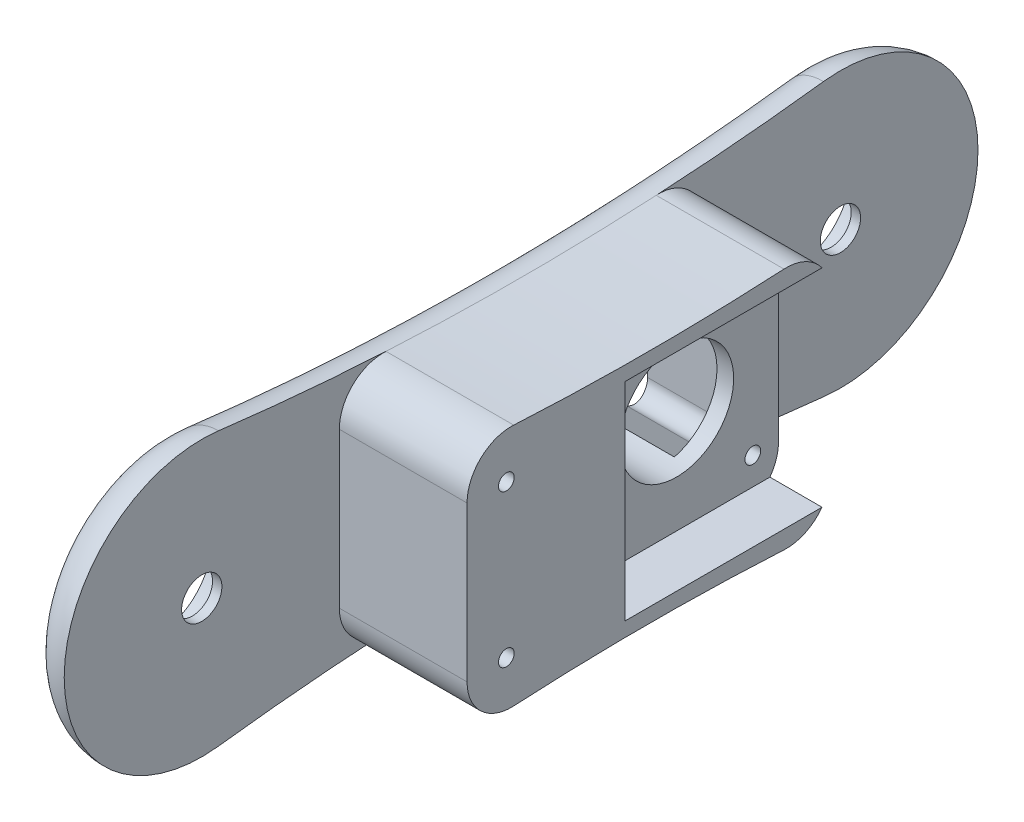
from build123d import *

# Parameters (mm, degrees)
BOSS_EXTRUDE1_DEPTH     = 35
CUT_EXTRUDE1_DEPTH      = 165.23458831805192
CUT_EXTRUDE1_DEPTH_BACK = 165.23458831805192
CUT_EXTRUDE2_START      = 35
CUT_EXTRUDE2_DEPTH      = 10.61
SKETCH5_R               = 1.600000000000005
SKETCH5_R_2             = 1.6000000000000056
CUT_EXTRUDE3_DEPTH      = 165.23458831805192
SKETCH5_3_R             = 3.0000000000000004
SKETCH5_3_R_2           = 3.0000000000000013
CUT_EXTRUDE4_DEPTH      = 21
SKETCH8_R               = 1.600000000000005
SKETCH8_R_2             = 1.6000000000000056
CUT_EXTRUDE5_DEPTH      = 165.23458831805192
SKETCH8_3_R             = 3.000000000000008
CUT_EXTRUDE6_DEPTH      = 25
CUT_EXTRUDE7_REACH      = 166.235
SKETCH7_R               = 4.1
SKETCH7_R_2             = 4.099999999999986
SKETCH7_3_R             = 11
SKETCH7_3_R_2           = 10.999999999999993
CUT_EXTRUDE8_DEPTH      = 7.1
CUT_EXTRUDE9_DEPTH      = 21
CUT_EXTRUDE11_START     = 24.39
SKETCH11_R              = 11.6
CUT_EXTRUDE11_DEPTH     = 189.6245883180519
FILLET3_R               = 9
FILLET4_R               = 9


with BuildPart() as part:
    # Sketch1 → Boss-Extrude1 (new body)
    with BuildSketch(Plane(origin=(0, 0, 0), x_dir=(0, 0, -1), z_dir=(1, 0, 0))):
        with BuildLine():
            ThreePointArc((-3.4331525583588727, 27.788729073331762), (-20.97770568525129, 18.545507924642443), (-28, 3.43e-15))
            Line((-28, 0), (28, 0))
            ThreePointArc((28, 0), (18.545507924642447, 20.977705685251287), (-3.4331525583588727, 27.788729073331762))
        make_face()
        with BuildLine():
            Line((28, 0), (-28, 0))
            ThreePointArc((-28, 3.43e-15), (-20.977705685251298, -18.545507924642436), (-3.433152558358892, -27.78872907333176))
            ThreePointArc((-3.433152558358892, -27.78872907333176), (18.545507924642436, -20.977705685251298), (28, -6.86e-15))
        make_face()
        with BuildLine():
            ThreePointArc((-126.56684744164114, 27.788729073331766), (-109.02229431474872, 18.54550792464245), (-102, 0))
            Line((-102, 0), (-28, 0))
            ThreePointArc((-28, 3.43e-15), (-20.97770568525129, 18.545507924642443), (-3.4331525583588727, 27.788729073331762))
            ThreePointArc((-3.433152558358863, 27.788729073331695), (-65, 23.999999999999602), (-126.56684744164116, 27.788729073331638))
        make_face()
        with BuildLine():
            Line((-28, 0), (-102, 0))
            ThreePointArc((-102, -6.86e-15), (-109.0222943147487, -18.545507924642447), (-126.56684744164114, -27.788729073331766))
            ThreePointArc((-126.56684744164116, -27.788729073331638), (-65, -23.999999999999602), (-3.433152558358863, -27.788729073331695))
            ThreePointArc((-3.433152558358892, -27.78872907333176), (-20.977705685251298, -18.545507924642436), (-28, 3.43e-15))
        make_face()
        with BuildLine():
            ThreePointArc((-126.56684744164114, 27.788729073331766), (-148.54550792464244, 20.977705685251287), (-158, 3.43e-15))
            Line((-158, 0), (-102, 0))
            ThreePointArc((-102, 0), (-109.02229431474872, 18.54550792464245), (-126.56684744164114, 27.788729073331766))
        make_face()
        with BuildLine():
            Line((-102, 0), (-158, 0))
            ThreePointArc((-158, 3.43e-15), (-148.54550792464244, -20.97770568525128), (-126.56684744164114, -27.788729073331766))
            ThreePointArc((-126.56684744164114, -27.788729073331766), (-109.0222943147487, -18.545507924642447), (-102, -6.86e-15))
        make_face()
    extrude(amount=BOSS_EXTRUDE1_DEPTH)

    # Sketch4 → Cut-Extrude1 (cut, two sides: drawn at the far end of the back side and taken through both)
    with BuildSketch(Plane(origin=(0, 0, 0), x_dir=(1, 0, 0), z_dir=(0, 1, 0)).offset(-CUT_EXTRUDE1_DEPTH_BACK)):
        Polygon((8.999999999999998, 27.999999999999996), (61, 27.999999999999996), (61, -28.000000000000004), (9.000000000000005, -28.000000000000004), align=None)
        Polygon((60.999999999999986, -157.99999999999997), (60.99999999999993, -101.99999999999999), (8.999999999999956, -101.99999999999999), (8.99999999999997, -157.99999999999997), align=None)
    extrude(amount=CUT_EXTRUDE1_DEPTH + CUT_EXTRUDE1_DEPTH_BACK, mode=Mode.SUBTRACT)

    # Sketch6 → Cut-Extrude2 (cut)
    with BuildSketch(Plane(origin=(0, 0, 0), x_dir=(0, 0, -1), z_dir=(1, 0, 0)).offset(CUT_EXTRUDE2_START)):
        Polygon((-27.624999999999996, -21.1), (-69.825, -21.100000000000005), (-69.825, 21.099999999999994), (-27.624999999999996, 21.1), align=None)
    extrude(amount=-CUT_EXTRUDE2_DEPTH, mode=Mode.SUBTRACT)

    # Sketch5 → Cut-Extrude3 (cut, through all)
    with BuildSketch(Plane(origin=(0, 0, 0), x_dir=(0, 0, -1), z_dir=(1, 0, 0))):
        with Locations(Location((-33.225, -15.5, 0), (0, 0, 180))):
            Circle(SKETCH5_R)
        with Locations(Location((-33.225, 15.5, 0), (0, 0, 180))):
            Circle(SKETCH5_R)
        with Locations(Location((-64.22500000000001, -15.500000000000004, 0), (0, 0, 180))):
            Circle(SKETCH5_R)
        with Locations(Location((-64.22500000000001, 15.499999999999995, 0), (0, 0, 180))):
            Circle(SKETCH5_R_2)
    extrude(amount=CUT_EXTRUDE3_DEPTH, mode=Mode.SUBTRACT)

    # Sketch5<3> → Cut-Extrude4 (cut)
    with BuildSketch(Plane(origin=(0, 0, 0), x_dir=(0, 0, -1), z_dir=(1, 0, 0))):
        with Locations(Location((-33.225, -15.5, 0), (0, 0, 180))):
            Circle(SKETCH5_3_R)
        with Locations(Location((-33.225, 15.5, 0), (0, 0, 180))):
            Circle(SKETCH5_3_R)
        with Locations(Location((-64.22500000000001, -15.500000000000004, 0), (0, 0, 180))):
            Circle(SKETCH5_3_R_2)
        with Locations(Location((-64.22500000000001, 15.499999999999995, 0), (0, 0, 180))):
            Circle(SKETCH5_3_R_2)
    extrude(amount=CUT_EXTRUDE4_DEPTH, mode=Mode.SUBTRACT)

    # Sketch8 → Cut-Extrude5 (cut, through all)
    with BuildSketch(Plane(origin=(0, 0, 0), x_dir=(0, 0, -1), z_dir=(1, 0, 0))):
        with Locations((-94, -15.500000000000012)):
            Circle(SKETCH8_R)
        with Locations((-94, 15.499999999999988)):
            Circle(SKETCH8_R_2)
    extrude(amount=CUT_EXTRUDE5_DEPTH, mode=Mode.SUBTRACT)

    # Sketch8<3> → Cut-Extrude6 (cut)
    with BuildSketch(Plane(origin=(0, 0, 0), x_dir=(0, 0, -1), z_dir=(1, 0, 0))):
        with Locations((-94, -15.500000000000012)):
            Circle(SKETCH8_3_R)
        with Locations((-94, 15.499999999999988)):
            Circle(SKETCH8_3_R)
    extrude(amount=CUT_EXTRUDE6_DEPTH, mode=Mode.SUBTRACT)

    # Sketch7 → Cut-Extrude7 (cut, up to next)
    with BuildSketch(Plane(origin=(0, 0, 0), x_dir=(0, 0, -1), z_dir=(1, 0, 0)), mode=Mode.PRIVATE) as cut_extrude7_sk1:
        with Locations(Location((0, 0, 0), (0, 0, 180))):
            Circle(SKETCH7_R)
    cut_extrude7_tool1 = extrude(cut_extrude7_sk1.sketch, amount=CUT_EXTRUDE7_REACH, mode=Mode.PRIVATE) & part.part
    # Sketch7 → Cut-Extrude7 (cut, up to next)
    with BuildSketch(Plane(origin=(0, 0, 0), x_dir=(0, 0, -1), z_dir=(1, 0, 0)), mode=Mode.PRIVATE) as cut_extrude7_sk2:
        with Locations(Location((-130, 0, 0), (0, 0, 180))):
            Circle(SKETCH7_R_2)
    cut_extrude7_tool2 = extrude(cut_extrude7_sk2.sketch, amount=CUT_EXTRUDE7_REACH, mode=Mode.PRIVATE) & part.part
    add(cut_extrude7_tool1.solids().sort_by_distance((0, 0, 0))[0], mode=Mode.SUBTRACT)
    add(cut_extrude7_tool2.solids().sort_by_distance((0, 0, 130))[0], mode=Mode.SUBTRACT)

    # Sketch7<3> → Cut-Extrude8 (cut)
    with BuildSketch(Plane(origin=(0, 0, 0), x_dir=(0, 0, -1), z_dir=(1, 0, 0))):
        Circle(SKETCH7_3_R)
        with Locations((-130, 0)):
            Circle(SKETCH7_3_R_2)
    extrude(amount=CUT_EXTRUDE8_DEPTH, mode=Mode.SUBTRACT)

    # Sketch9 → Cut-Extrude9 (cut)
    with BuildSketch(Plane(origin=(0, 0, 0), x_dir=(0, 0, -1), z_dir=(1, 0, 0))):
        with BuildLine():
            Line((-52.942405411719506, -6.7980505730098315), (-34.806527029394815, -18.04926896487869))
            ThreePointArc((-34.80652702939481, -18.049268964878678), (-34.68366701337481, -12.878494603459266), (-30.22500000000001, -15.5))
            Line((-30.225000000000005, -15.5), (-30.225000000000005, 15.5))
            ThreePointArc((-30.225, 15.5), (-34.68366701337481, 12.878494603459261), (-34.806527029394815, 18.04926896487868))
            Line((-34.806527029394815, 18.04926896487869), (-52.942405411719506, 6.7980505730098315))
            ThreePointArc((-52.9424054117195, 6.7980505730098155), (-56.725, 9.8e-16), (-52.9424054117195, -6.798050573009815))
        make_face()
    extrude(amount=CUT_EXTRUDE9_DEPTH, mode=Mode.SUBTRACT)

    # Sketch11 → Cut-Extrude11 (cut, through all)
    with BuildSketch(Plane(origin=(0, 0, 0), x_dir=(0, 0, -1), z_dir=(1, 0, 0)).offset(CUT_EXTRUDE11_START)):
        with Locations(Location((-48.725, 0, 0), (0, 0, 75.417643506))):
            Circle(SKETCH11_R)
    extrude(amount=-CUT_EXTRUDE11_DEPTH, mode=Mode.SUBTRACT)

    # Fillet3
    # the kernel refuses this fillet: 9 mm, written as the material it takes off along each edge
    with BuildSketch(Plane(origin=(0, -7.11e-15, 130), x_dir=(0, 0.9924546097618487, -0.12261259136995861), z_dir=(0, -0.12261259136995861, -0.9924546097618487))) as fillet3_piece_1:
        with BuildLine():
            CenterArc((28 - FILLET3_R, FILLET3_R), FILLET3_R, 270, 89.99999999999999)
            Line((28, FILLET3_R), (28, 0))
            Line((28, 0), (28 - FILLET3_R, 0))
        make_face()
    revolve(axis=Axis((0, -7.11e-15, 130), (1, 0, 0)), revolution_arc=194.0858135076888, mode=Mode.SUBTRACT)
    with BuildSketch(Plane(origin=(0, -526.1249999999588, 65.00000000000026), x_dir=(0, 0.9924546097618475, 0.12261259136996942), z_dir=(0, -0.12261259136996942, 0.9924546097618475))) as fillet3_piece_2:
        with BuildLine():
            CenterArc((502.1249999999593 + FILLET3_R, -FILLET3_R), FILLET3_R, 90, 90)
            Line((502.1249999999593 + FILLET3_R, 1.78e-15), (502.1249999999593, 0))
            Line((502.1249999999593, 0), (502.1249999999593, -FILLET3_R))
        make_face()
    revolve(axis=Axis((0, -526.1249999999588, 65.00000000000026), (-1, 0, 0)), revolution_arc=14.085813507690109, mode=Mode.SUBTRACT)
    with BuildSketch(Plane(origin=(0, 1.78e-15, -1.78e-15), x_dir=(0, -0.9924546097618486, 0.12261259136995943), z_dir=(0, 0.12261259136995943, 0.9924546097618486))) as fillet3_piece_3:
        with BuildLine():
            CenterArc((27.999999999999993 - FILLET3_R, FILLET3_R), FILLET3_R, 270, 89.99999999999999)
            Line((27.999999999999993, FILLET3_R), (27.999999999999993, 0))
            Line((27.999999999999993, 0), (27.999999999999993 - FILLET3_R, 0))
        make_face()
    revolve(axis=Axis((0, 1.78e-15, -1.78e-15), (1, 0, 0)), revolution_arc=194.0858135076889, mode=Mode.SUBTRACT)
    with BuildSketch(Plane(origin=(0, 526.1249999999663, 65.00000000000024), x_dir=(0, -0.9924546097618476, -0.12261259136996856), z_dir=(0, 0.12261259136996856, -0.9924546097618476))) as fillet3_piece_4:
        with BuildLine():
            CenterArc((502.1249999999667 + FILLET3_R, -FILLET3_R), FILLET3_R, 90, 90)
            Line((502.1249999999667 + FILLET3_R, 1.78e-15), (502.1249999999667, 0))
            Line((502.1249999999667, 0), (502.1249999999667, -FILLET3_R))
        make_face()
    revolve(axis=Axis((0, 526.1249999999663, 65.00000000000024), (-1, 0, 0)), revolution_arc=14.085813507689899, mode=Mode.SUBTRACT)

    # Fillet4
    fillet4_edges = [part.edges().sort_by_distance(p)[0] for p in [
        (22.000000000000004, -25.365061880944552, 28),
        (21.99999999999998, -25.365061880944495, 101.99999999999999),
        (21.99999999999998, 25.365061880944552, 101.99999999999999),
        (22.000000000000004, 25.36506188094461, 28),
    ]]
    fillet(fillet4_edges, radius=FILLET4_R)


solid = part.part
